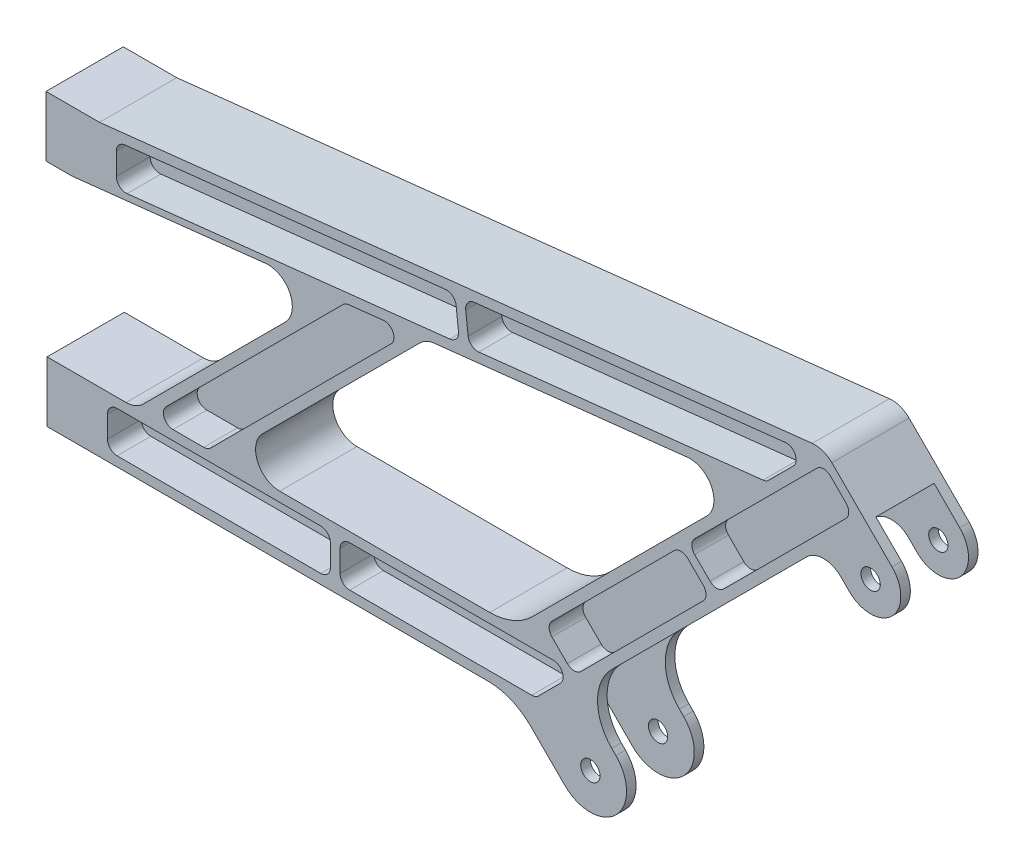
from build123d import *

# Parameters (mm, degrees)
SKETCH1_R               = 4
BOSS_EXTRUDE1_DEPTH     = 32
CUT_EXTRUDE1_DEPTH      = 14
CUT_EXTRUDE2_DEPTH      = 12.0515
CUT_EXTRUDE2_DEPTH_BACK = 12.0515


with BuildPart() as part:
    # Sketch1 → Boss-Extrude1 (new body)
    with BuildSketch(Plane.XY):
        with BuildLine():
            Line((-16.049733998, 33.731487379), (8.839559806, 8.838109599))
            ThreePointArc((8.839559806, 8.838109599), (12.499999987, -0.000512728), (8.838834763, -8.838834767))
            ThreePointArc((8.838834763, -8.838834767), (-2e-09, -12.5), (-8.838834765, -8.838834765))
            Line((-8.838834765, -8.838834765), (-12.374368672, -5.303300858))
            ThreePointArc((-12.374368672, -5.303300858), (-19.445436483, -2.37436867), (-26.516504295, -5.303300858))
            Line((-26.516504295, -5.303300858), (-107.248737345, -86.035533908))
            ThreePointArc((-107.248737345, -86.035533908), (-113.106601722, -100.177669532), (-107.248737345, -114.319805156))
            Line((-107.248737345, -114.319805156), (-105.480970392, -116.087572109))
            ThreePointArc((-105.480970392, -116.087572109), (-101.08757211, -126.694173826), (-105.480970392, -137.300775544))
            ThreePointArc((-105.480970392, -137.300775544), (-116.08757211, -141.694173826), (-126.694173828, -137.300775544))
            Line((-126.694173828, -137.300775544), (-140.832552861, -123.162396511))
            ThreePointArc((-140.832552861, -123.162396511), (-148.943136582, -117.743077728), (-158.510222391, -115.840066041))
            Line((-158.510222391, -115.840066041), (-341.137300972, -115.840066041))
            Line((-341.137300972, -115.840066041), (-341.137300972, -90.840066041))
            Line((-341.137300972, -90.840066041), (-308.412362541, -90.840066041))
            ThreePointArc((-308.412362541, -90.840066041), (-304.585528218, -90.078861366), (-301.34129473, -87.911133852))
            Line((-301.34129473, -87.911133852), (-242.481383951, -29.051223074))
            ThreePointArc((-242.481383951, -29.051223074), (-240.53681892, -17.653682746), (-250.644825977, -12.039998394))
            Line((-250.644825977, -12.039998394), (-330.179319753, -20.780446989))
            ThreePointArc((-330.179319753, -20.780446989), (-330.724687884, -20.82531813), (-331.271693968, -20.840290121))
            Line((-331.271693968, -20.840290121), (-341.577601675, -20.840290121))
            Line((-341.577601675, -20.840290121), (-341.577601675, 4.159709879))
            Line((-341.577601675, 4.159709879), (-319.417601674, 4.159709879))
            Line((-319.417601674, 4.159709879), (-24.213756083, 36.601156542))
            ThreePointArc((-24.213756083, 36.601156542), (-19.80525783, 36.095156835), (-16.049733998, 33.731487379))
        make_face()
        with Locations((-116.08757211, -126.694173826)):
            Circle(SKETCH1_R, mode=Mode.SUBTRACT)
        with Locations((-3e-09, -3e-09)):
            Circle(SKETCH1_R, mode=Mode.SUBTRACT)
        with BuildLine():
            Line((-157.763947596, -90.840066041), (-244.772752235, -90.840066041))
            ThreePointArc((-244.772752235, -90.840066041), (-254.01154756, -84.666900364), (-251.843820046, -73.768998229))
            Line((-251.843820046, -73.768998229), (-186.691765829, -8.616944011))
            ThreePointArc((-186.691765829, -8.616944011), (-183.947170533, -6.67237898), (-180.713072231, -5.747854954))
            Line((-180.713072231, -5.747854954), (-75.981590903, 5.7616183))
            ThreePointArc((-75.981590903, 5.7616183), (-65.873583845, 0.147933947), (-67.818148877, -11.24960638))
            Line((-67.818148877, -11.24960638), (-140.086278067, -83.51773557))
            ThreePointArc((-140.086278067, -83.51773557), (-148.196861787, -88.937054353), (-157.763947596, -90.840066041))
        make_face(mode=Mode.SUBTRACT)
    extrude(amount=BOSS_EXTRUDE1_DEPTH)

    # Sketch2 → Cut-Extrude1 (cut)
    with BuildSketch(Plane.XY.offset(32)):
        with BuildLine():
            ThreePointArc((-140.366977977, -111.840066041), (-138.836244247, -111.535584171), (-137.538550852, -110.668493165))
            Line((-137.538550852, -110.668493165), (-128.538550852, -101.668493165))
            ThreePointArc((-128.538550852, -101.668493165), (-127.671459847, -97.309332311), (-131.366977977, -94.840066041))
            Line((-131.366977977, -94.840066041), (-215.770021637, -94.840066041))
            ThreePointArc((-215.770021637, -94.840066041), (-218.598448762, -96.011638916), (-219.770021637, -98.840066041))
            Line((-219.770021637, -98.840066041), (-219.770021637, -107.840066041))
            ThreePointArc((-219.770021637, -107.840066041), (-218.598448762, -110.668493165), (-215.770021637, -111.840066041))
            Line((-215.770021637, -111.840066041), (-140.366977977, -111.840066041))
        make_face()
        with BuildLine():
            ThreePointArc((-16.614921093, 28.639448842), (-19.443416168, 29.811253755), (-22.272007364, 28.639680883))
            Line((-22.272007364, 28.639680883), (-72.893028462, -21.981340215))
            ThreePointArc((-72.893028462, -21.981340215), (-74.064601337, -24.80976734), (-72.893028462, -27.638194464))
            Line((-72.893028462, -27.638194464), (-66.529067431, -34.002155495))
            ThreePointArc((-66.529067431, -34.002155495), (-63.700640306, -35.17372837), (-60.872213182, -34.002155495))
            Line((-60.872213182, -34.002155495), (-10.251714155, 16.618343532))
            ThreePointArc((-10.251714155, 16.618343532), (-9.080141283, 19.446606586), (-10.251482133, 22.274965741))
            Line((-10.251482133, 22.274965741), (-16.614921093, 28.639448842))
        make_face()
        with BuildLine():
            ThreePointArc((-125.633513656, -93.10660172), (-122.805086531, -94.278174595), (-119.976659407, -93.10660172))
            Line((-119.976659407, -93.10660172), (-69.357494556, -42.487436869))
            ThreePointArc((-69.357494556, -42.487436869), (-68.185921681, -39.659009745), (-69.357494556, -36.83058262))
            Line((-69.357494556, -36.83058262), (-75.721455587, -30.466621589))
            ThreePointArc((-75.721455587, -30.466621589), (-78.549882711, -29.295048714), (-81.378309836, -30.466621589))
            Line((-81.378309836, -30.466621589), (-131.997474687, -81.08578644))
            ThreePointArc((-131.997474687, -81.08578644), (-133.169047562, -83.914213565), (-131.997474687, -86.742640689))
            Line((-131.997474687, -86.742640689), (-125.633513656, -93.10660172))
        make_face()
        with BuildLine():
            ThreePointArc((-316.137300972, -107.840066041), (-314.965728097, -110.668493165), (-312.137300972, -111.840066041))
            Line((-312.137300972, -111.840066041), (-227.770021637, -111.840066041))
            ThreePointArc((-227.770021637, -111.840066041), (-224.941594512, -110.668493165), (-223.770021637, -107.840066041))
            Line((-223.770021637, -107.840066041), (-223.770021637, -98.840066041))
            ThreePointArc((-223.770021637, -98.840066041), (-224.941594512, -96.011638916), (-227.770021637, -94.840066041))
            Line((-227.770021637, -94.840066041), (-312.137300972, -94.840066041))
            ThreePointArc((-312.137300972, -94.840066041), (-314.965728097, -96.011638916), (-316.137300972, -98.840066041))
            Line((-316.137300972, -98.840066041), (-316.137300972, -107.840066041))
        make_face()
        with BuildLine():
            Line((-176.109143129, 15.884521302), (-308.890718748, 1.292481031))
            ThreePointArc((-308.890718748, 1.292481031), (-311.432678153, -0.014105995), (-312.453769063, -2.683581717))
            Line((-312.453769063, -2.683581717), (-312.453769063, -11.737764783))
            ThreePointArc((-312.453769063, -11.737764783), (-311.123244784, -14.716673874), (-308.016819377, -15.713827531))
            Line((-308.016819377, -15.713827531), (-174.252106965, -1.013745374))
            ThreePointArc((-174.252106965, -1.013745374), (-171.568585634, 0.459786528), (-170.712993903, 3.399267059))
            Line((-170.712993903, 3.399267059), (-171.696130696, 12.345408241))
            ThreePointArc((-171.696130696, 12.345408241), (-173.169662598, 15.028929572), (-176.109143129, 15.884521302))
        make_face()
        with BuildLine():
            Line((-42.183809279, 14.384733217), (-32.011769174, 24.556773322))
            ThreePointArc((-32.011769174, 24.556773322), (-31.233943162, 29.115789453), (-35.277145985, 31.361263195))
            Line((-35.277145985, 31.361263195), (-164.180954887, 17.19537036))
            ThreePointArc((-164.180954887, 17.19537036), (-166.864476218, 15.721838457), (-167.720067949, 12.782357926))
            Line((-167.720067949, 12.782357926), (-166.736931156, 3.836216744))
            ThreePointArc((-166.736931156, 3.836216744), (-165.263399254, 1.152695413), (-162.323918722, 0.297103683))
            Line((-162.323918722, 0.297103683), (-44.575286718, 13.237097595))
            ThreePointArc((-44.575286718, 13.237097595), (-43.281647397, 13.606907205), (-42.183809279, 14.384733217))
        make_face()
        with BuildLine():
            ThreePointArc((-216.174337973, -9.644873162), (-217.467977294, -10.014682772), (-218.565815412, -10.792508784))
            Line((-218.565815412, -10.792508784), (-291.784945543, -84.011638916))
            ThreePointArc((-291.784945543, -84.011638916), (-292.652036549, -88.37079977), (-288.956518419, -90.840066041))
            Line((-288.956518419, -90.840066041), (-276.228596357, -90.840066041))
            ThreePointArc((-276.228596357, -90.840066041), (-274.697862628, -90.535584171), (-273.400169233, -89.668493165))
            Line((-273.400169233, -89.668493165), (-198.609611049, -14.877934982))
            ThreePointArc((-198.609611049, -14.877934982), (-197.831785036, -10.318918851), (-201.874987859, -8.07344511))
            Line((-201.874987859, -8.07344511), (-216.174337973, -9.644873162))
        make_face()
    cut_extrude1 = extrude(amount=-CUT_EXTRUDE1_DEPTH, mode=Mode.SUBTRACT)

    # Mirror1: Cut-Extrude1 across plane
    add(cut_extrude1.mirror(Plane.XY.offset(16)), mode=Mode.SUBTRACT)

    # Sketch3 → Cut-Extrude2 (cut, two sides: drawn at the far end of the back side and taken through both)
    with BuildSketch(Plane.XY.offset(16).offset(-CUT_EXTRUDE2_DEPTH_BACK)):
        with BuildLine():
            Line((-158.510222391, -115.840066041), (-141.195405101, -115.840066041))
            ThreePointArc((-141.195405101, -115.840066041), (-137.368570778, -115.078861366), (-134.12433729, -112.911133852))
            Line((-134.12433729, -112.911133852), (-98.96898095, -77.755777513))
            Line((-98.96898095, -77.755777513), (-66.359743398, -110.018550272))
            Line((-66.359743398, -110.018550272), (-116.59713847, -149.218566919))
            Line((-116.59713847, -149.218566919), (-158.510222391, -115.840066041))
        make_face()
        Polygon((-29.015558543, -7.802355106), (7.869814205, 29.083017642), (26.353299235, -15.387889097), (-12.04102058, -17.818970482), align=None)
    extrude(amount=CUT_EXTRUDE2_DEPTH + CUT_EXTRUDE2_DEPTH_BACK, mode=Mode.SUBTRACT)


solid = part.part
